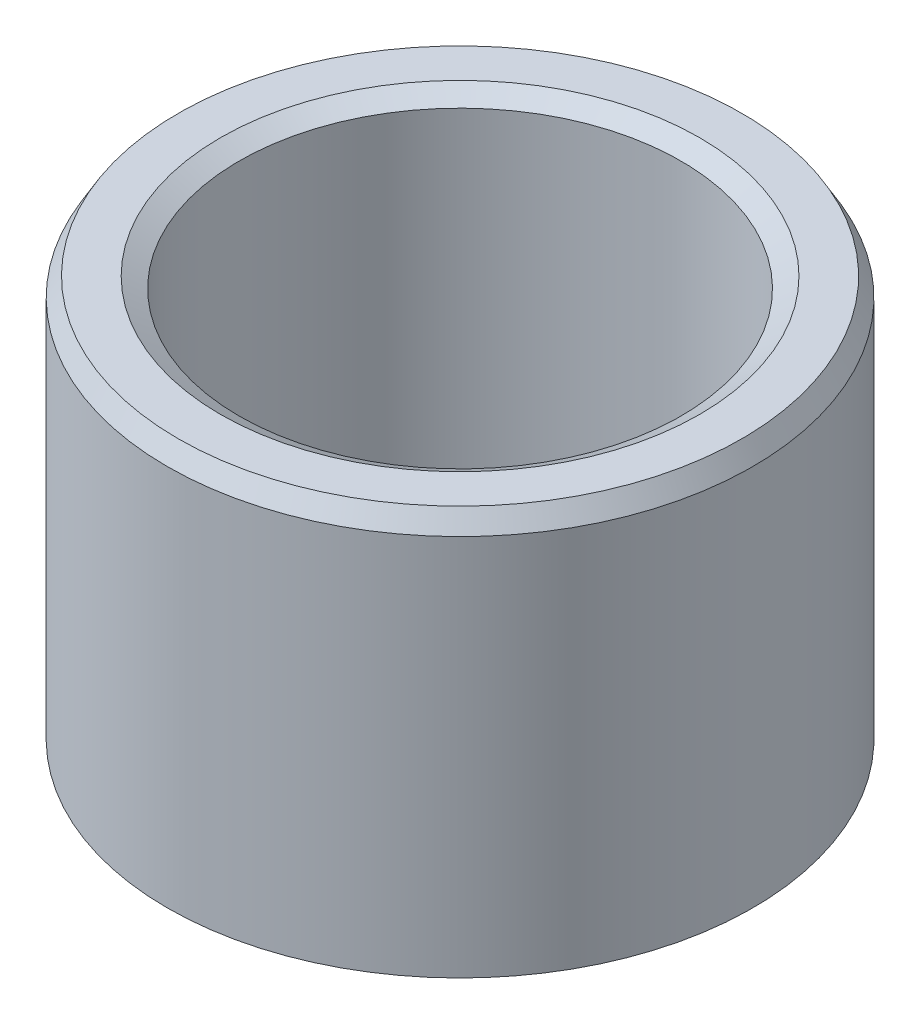
from build123d import *
from OCP.BRepFilletAPI import BRepFilletAPI_MakeChamfer

# Parameters (mm, degrees)
SKETCH1_R           = 50
BOSS_EXTRUDE1_DEPTH = 70.351940089
SKETCH2_R           = 37.744850288
CUT_EXTRUDE1_DEPTH  = 100.746656456
CHAMFER1_SIZE       = 3.199251935
CHAMFER1_SIZE2      = 1.847088966


with BuildPart() as part:
    # Sketch1 → Boss-Extrude1 (new body)
    with BuildSketch(Plane(origin=(0, 0, 0), x_dir=(1, 0, 0), z_dir=(0, 1, 0))):
        Circle(SKETCH1_R)
    extrude(amount=BOSS_EXTRUDE1_DEPTH)

    # Sketch2 → Cut-Extrude1 (cut, through all)
    with BuildSketch(Plane(origin=(0, 0, 0), x_dir=(1, 0, 0), z_dir=(0, 1, 0))):
        Circle(SKETCH2_R)
    extrude(amount=CUT_EXTRUDE1_DEPTH, mode=Mode.SUBTRACT)

    # Chamfer1: one chamfer whose edges measure the first distance from different faces: ONE call of the kernel's chamfer builder (chamfer() names one face for all edges)
    chamfer1_edges_1 = [part.edges().sort_by_distance(p)[0] for p in [
        (-37.744850288, 70.351940089, 0),
    ]]
    chamfer1_side_1 = [part.faces().sort_by_distance(p)[0] for p in [
        (-48.585786438, 70.351940089, 0),
    ]]
    chamfer1_edges_2 = [part.edges().sort_by_distance(p)[0] for p in [
        (-37.744850288, 0, 0),
    ]]
    chamfer1_side_2 = [part.faces().sort_by_distance(p)[0] for p in [
        (-37.744850288, 35.175970044, 0),
    ]]
    chamfer1_edges_3 = [part.edges().sort_by_distance(p)[0] for p in [
        (-50, 0, 0),
    ]]
    chamfer1_side_3 = [part.faces().sort_by_distance(p)[0] for p in [
        (-48.585786438, 0, 0),
    ]]
    chamfer1_edges_4 = [part.edges().sort_by_distance(p)[0] for p in [
        (-50, 70.351940089, 0),
    ]]
    chamfer1_side_4 = [part.faces().sort_by_distance(p)[0] for p in [
        (-50, 35.175970044, 0),
    ]]
    chamfer1 = BRepFilletAPI_MakeChamfer(part.part.solid().wrapped)
    for e in chamfer1_edges_1:
        chamfer1.Add(CHAMFER1_SIZE, CHAMFER1_SIZE2, e.wrapped, chamfer1_side_1[0].wrapped)  # the first distance lies on this face
    for e in chamfer1_edges_2:
        chamfer1.Add(CHAMFER1_SIZE, CHAMFER1_SIZE2, e.wrapped, chamfer1_side_2[0].wrapped)  # the first distance lies on this face
    for e in chamfer1_edges_3:
        chamfer1.Add(CHAMFER1_SIZE, CHAMFER1_SIZE2, e.wrapped, chamfer1_side_3[0].wrapped)  # the first distance lies on this face
    for e in chamfer1_edges_4:
        chamfer1.Add(CHAMFER1_SIZE, CHAMFER1_SIZE2, e.wrapped, chamfer1_side_4[0].wrapped)  # the first distance lies on this face
    add(Compound.cast(chamfer1.Shape()), mode=Mode.REPLACE)


solid = part.part
